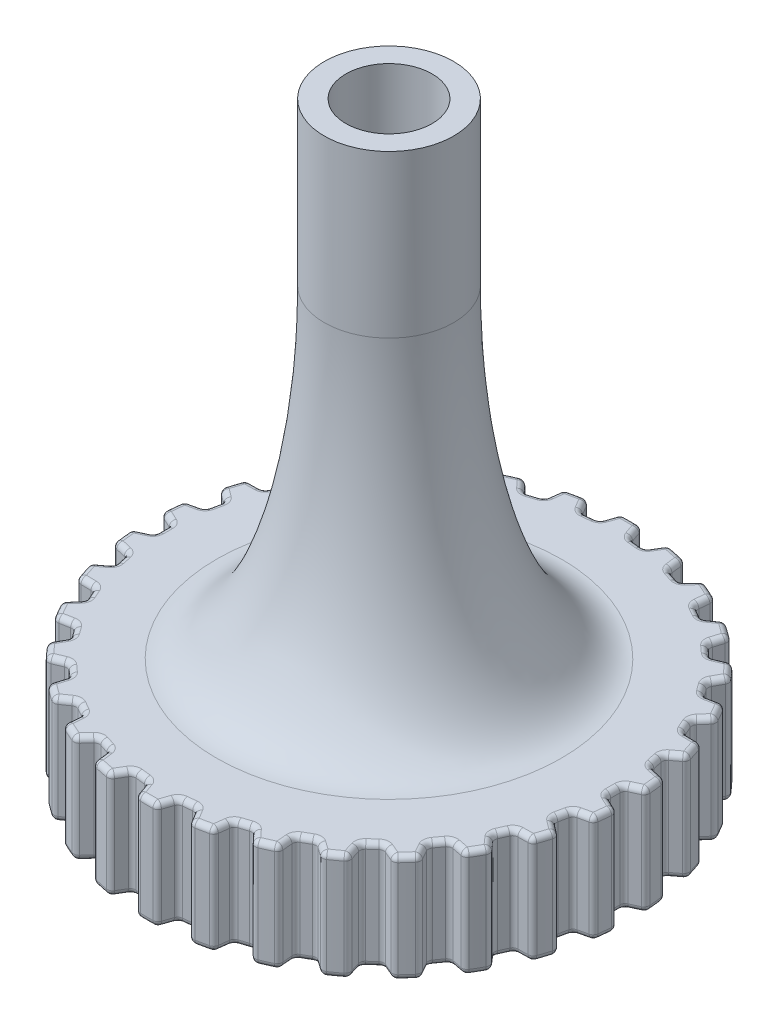
from build123d import *

# Parameters (mm, degrees)
ZAOKR_GLENIE1_SIZE              = 10
ZAOKR_GLENIE1_SIZE_2            = 30
WYTNIJ_WYCI_GNI_CIE1_REACH      = 65.541
ZAOKR_GLENIE2_R                 = 0.5
SZYK_KO_OWY1_COUNT              = 30
ZAOKR_GLENIE2_OF_SZYK_KO_OWY1_R = 0.5
ZAOKR_GLENIE3_R                 = 0.5


with BuildPart() as part:
    # Szkic1 → Obrót1 (revolve)
    with BuildSketch(Plane.XY, mode=Mode.PRIVATE) as obr_t1_sk:
        Polygon((0, -45), (0, -55), (22.5, -55), (22.5, -45), (6, -45), (6, 0), (4, 0), (4, -45), align=None)
    revolve(obr_t1_sk.sketch.rotate(Axis((0, 0, 0), (0, 1, 0)), 90), axis=Axis((0, 0, 0), (0, 1, 0)))

    # Zaokrąglenie1
    # an asymmetric fillet: 30, 10 mm, written as the material it adds along each edge
    with BuildSketch(Plane(origin=(0, -45, 0), x_dir=(0, 0, -1), z_dir=(1, 0, 0))) as zaokr_glenie1_piece_1:
        with BuildLine():
            Bezier((6 + ZAOKR_GLENIE1_SIZE, 0), (6, 0), (6, ZAOKR_GLENIE1_SIZE_2), weights=[1, 0.707106781, 1])
            Line((6, ZAOKR_GLENIE1_SIZE_2), (6, 0))
            Line((6, 0), (6 + ZAOKR_GLENIE1_SIZE, 0))
        make_face()
    revolve(axis=Axis((0, -45, 0), (0, 1, 0)))

    # Szkic2 → Wytnij-wyciągnięcie1 (cut, up to next)
    with BuildSketch(Plane(origin=(0, -55, 0), x_dir=(-1, 0, 0), z_dir=(0, -1, 0)), mode=Mode.PRIVATE) as wytnij_wyci_gni_cie1_sk1:
        Polygon((23.5, 1.915769145), (21, 0.75), (21, -0.75), (23.5, -1.915769145), align=None)
    wytnij_wyci_gni_cie1_tool1 = extrude(wytnij_wyci_gni_cie1_sk1.sketch, amount=-WYTNIJ_WYCI_GNI_CIE1_REACH, mode=Mode.PRIVATE) & part.part
    wytnij_wyci_gni_cie1 = wytnij_wyci_gni_cie1_tool1.solids().sort_by_distance((-22.432213, -55, 0))[0]
    add(wytnij_wyci_gni_cie1, mode=Mode.SUBTRACT)

    # Zaokrąglenie2
    zaokr_glenie2_edges = [part.edges().sort_by_distance(p)[0] for p in [
        (-22.454619967, -50, -1.428300431),
        (-22.454619967, -50, 1.428300431),
        (-21, -50, -0.75),
        (-21, -50, 0.75),
    ]]
    fillet(zaokr_glenie2_edges, radius=ZAOKR_GLENIE2_R)

    # Szyk kołowy1: Wytnij-wyciągnięcie1 ×30 about axis
    szyk_ko_owy1_axis = Axis((0, 0, 0), (0, 1, 0))
    for i in range(1, SZYK_KO_OWY1_COUNT):
        add(wytnij_wyci_gni_cie1.rotate(szyk_ko_owy1_axis, i * 360 / SZYK_KO_OWY1_COUNT), mode=Mode.SUBTRACT)

    # Zaokrąglenie2 of Szyk kołowy1
    zaokr_glenie2_of_szyk_ko_owy1_edges = [part.edges().sort_by_distance(p)[0] for p in [
        (-22.260893004, -50, 3.271489365),
        (-21.666972289, -50, 6.065666643),
        (-20.697033384, -50, 3.632534807),
        (-20.385165847, -50, 5.099756208),
        (-21.094258197, -50, 7.828299377),
        (-19.932373952, -50, 10.437934118),
        (-19.489507093, -50, 7.856310411),
        (-18.879402128, -50, 9.226628598),
        (-19.005703085, -50, 12.042975141),
        (-17.326635227, -50, 14.354013784),
        (-17.430195821, -50, 11.736727552),
        (-16.548517943, -50, 12.950253044),
        (-16.086507548, -50, 15.731315104),
        (-13.9636394, -50, 17.64275417),
        (-14.609101353, -50, 15.10419338),
        (-13.494384114, -50, 16.10788929),
        (-12.464254441, -50, 18.732121109),
        (-9.990365527, -50, 20.160421539),
        (-11.149519053, -50, 17.811533479),
        (-9.850480947, -50, 18.561533479),
        (-8.297253604, -50, 20.914243535),
        (-5.580464741, -50, 21.796981747),
        (-7.202649269, -50, 19.740424096),
        (-5.776064495, -50, 20.203949588),
        (-3.76762297, -50, 22.182313161),
        (-0.926670867, -50, 22.480909259),
        (-2.94098915, -50, 20.806563455),
        (-1.449206307, -50, 20.96335615),
        (0.926670867, -50, 22.480909259),
        (3.76762297, -50, 22.182313161),
        (1.449206307, -50, 20.96335615),
        (2.94098915, -50, 20.806563455),
        (5.580464741, -50, 21.796981747),
        (8.297253604, -50, 20.914243535),
        (5.776064495, -50, 20.203949588),
        (7.202649269, -50, 19.740424096),
        (9.990365527, -50, 20.160421539),
        (12.464254441, -50, 18.732121109),
        (9.850480947, -50, 18.561533479),
        (11.149519053, -50, 17.811533479),
        (13.9636394, -50, 17.64275417),
        (16.086507548, -50, 15.731315104),
        (13.494384114, -50, 16.10788929),
        (14.609101353, -50, 15.10419338),
        (17.326635227, -50, 14.354013784),
        (19.005703085, -50, 12.042975141),
        (16.548517943, -50, 12.950253044),
        (17.430195821, -50, 11.736727552),
        (19.932373952, -50, 10.437934118),
        (21.094258197, -50, 7.828299377),
        (18.879402128, -50, 9.226628598),
        (19.489507093, -50, 7.856310411),
        (21.666972289, -50, 6.065666643),
        (22.260893004, -50, 3.271489365),
        (20.385165847, -50, 5.099756208),
        (20.697033384, -50, 3.632534807),
        (22.454619967, -50, 1.428300431),
        (22.454619967, -50, -1.428300431),
        (21, -50, 0.75),
        (21, -50, -0.75),
        (22.260893004, -50, -3.271489365),
        (21.666972289, -50, -6.065666643),
        (20.697033384, -50, -3.632534807),
        (20.385165847, -50, -5.099756208),
        (21.094258197, -50, -7.828299377),
        (19.932373952, -50, -10.437934118),
        (19.489507093, -50, -7.856310411),
        (18.879402128, -50, -9.226628598),
        (19.005703085, -50, -12.042975141),
        (17.326635227, -50, -14.354013784),
        (17.430195821, -50, -11.736727552),
        (16.548517943, -50, -12.950253044),
        (16.086507548, -50, -15.731315104),
        (13.9636394, -50, -17.64275417),
        (14.609101353, -50, -15.10419338),
        (13.494384114, -50, -16.10788929),
        (12.464254441, -50, -18.732121109),
        (9.990365527, -50, -20.160421539),
        (11.149519053, -50, -17.811533479),
        (9.850480947, -50, -18.561533479),
        (8.297253604, -50, -20.914243535),
        (5.580464741, -50, -21.796981747),
        (7.202649269, -50, -19.740424096),
        (5.776064495, -50, -20.203949588),
        (3.76762297, -50, -22.182313161),
        (0.926670867, -50, -22.480909259),
        (2.94098915, -50, -20.806563455),
        (1.449206307, -50, -20.96335615),
        (-0.926670867, -50, -22.480909259),
        (-3.76762297, -50, -22.182313161),
        (-1.449206307, -50, -20.96335615),
        (-2.94098915, -50, -20.806563455),
        (-5.580464741, -50, -21.796981747),
        (-8.297253604, -50, -20.914243535),
        (-5.776064495, -50, -20.203949588),
        (-7.202649269, -50, -19.740424096),
        (-9.990365527, -50, -20.160421539),
        (-12.464254441, -50, -18.732121109),
        (-9.850480947, -50, -18.561533479),
        (-11.149519053, -50, -17.811533479),
        (-13.9636394, -50, -17.64275417),
        (-16.086507548, -50, -15.731315104),
        (-13.494384114, -50, -16.10788929),
        (-14.609101353, -50, -15.10419338),
        (-17.326635227, -50, -14.354013784),
        (-19.005703085, -50, -12.042975141),
        (-16.548517943, -50, -12.950253044),
        (-17.430195821, -50, -11.736727552),
        (-19.932373952, -50, -10.437934118),
        (-21.094258197, -50, -7.828299377),
        (-18.879402128, -50, -9.226628598),
        (-19.489507093, -50, -7.856310411),
        (-21.666972289, -50, -6.065666643),
        (-22.260893004, -50, -3.271489365),
        (-20.385165847, -50, -5.099756208),
        (-20.697033384, -50, -3.632534807),
    ]]
    fillet(zaokr_glenie2_of_szyk_ko_owy1_edges, radius=ZAOKR_GLENIE2_OF_SZYK_KO_OWY1_R)

    # Zaokrąglenie3
    zaokr_glenie3_edges = [part.edges().sort_by_distance(p)[0] for p in [
        (-9.919306723, -45, 19.348215701),
        (-9.932835045, -45, 18.60440431),
        (-10.5, -45, 18.186533479),
        (-11.145469232, -45, 17.904289636),
        (-11.796392953, -45, 18.264479461),
        (-12.467057648, -45, 18.625140895),
        (-13.225168177, -45, 18.202882373),
        (-13.861028932, -45, 17.612361475),
        (-13.725266313, -45, 16.863070934),
        (-13.583851925, -45, 16.13270091),
        (-14.051742734, -45, 15.606041335),
        (-14.624425119, -45, 15.195764597),
        (-15.336012271, -45, 15.412748759),
        (-16.067007062, -45, 15.626089845),
        (-16.720758573, -45, 15.055438643),
        (-17.219948047, -45, 14.345619158),
        (-16.931365904, -45, 13.640929049),
        (-16.641189293, -45, 12.955921066),
        (-16.989356882, -45, 12.343490298),
        (-17.464223453, -45, 11.823111728),
        (-18.205374262, -45, 11.887406977),
        (-18.964751169, -45, 11.944103686),
        (-19.485571585, -45, 11.25),
        (-19.826272802, -45, 10.451904446),
        (-19.397483559, -45, 9.822613108),
        (-18.971226835, -45, 9.212905303),
        (-19.18445461, -45, 8.541469505),
        (-19.540751419, -45, 7.933732143),
        (-20.279074039, -45, 7.842528469),
        (-21.033644647, -45, 7.740102882),
        (-21.398771617, -45, 6.952882373),
        (-21.566094298, -45, 6.101391356),
        (-21.015838103, -45, 5.57500184),
        (-20.472130731, -45, 5.06724137),
        (-20.541099615, -45, 4.366145507),
        (-20.763254782, -45, 3.697610393),
        (-21.466480971, -45, 3.454893834),
        (-22.183266924, -45, 3.197822441),
        (-22.376742646, -45, 2.351890424),
        (-22.363373988, -45, 1.484218186),
        (-21.715699676, -45, 1.08373624),
        (-21.078304277, -45, 0.700114674),
        (-21, -45, 0),
        (-21.078304277, -45, -0.700114674),
        (-21.715699676, -45, -1.08373624),
        (-22.363373988, -45, -1.484218186),
        (-22.376742646, -45, -2.351890424),
        (-22.183266924, -45, -3.197822441),
        (-21.466480971, -45, -3.454893834),
        (-20.763254782, -45, -3.697610393),
        (-20.541099615, -45, -4.366145507),
        (-20.472130731, -45, -5.06724137),
        (-21.015838103, -45, -5.57500184),
        (-21.566094298, -45, -6.101391356),
        (-21.398771617, -45, -6.952882373),
        (-21.033644647, -45, -7.740102882),
        (-20.279074039, -45, -7.842528469),
        (-19.540751419, -45, -7.933732143),
        (-19.18445461, -45, -8.541469505),
        (-18.971226835, -45, -9.212905303),
        (-19.397483559, -45, -9.822613108),
        (-19.826272802, -45, -10.451904446),
        (-19.485571585, -45, -11.25),
        (-18.964751169, -45, -11.944103686),
        (-18.205374262, -45, -11.887406977),
        (-17.464223453, -45, -11.823111728),
        (-16.989356882, -45, -12.343490298),
        (-16.641189293, -45, -12.955921066),
        (-16.931365904, -45, -13.640929049),
        (-17.219948047, -45, -14.345619158),
        (-16.720758573, -45, -15.055438643),
        (-16.067007062, -45, -15.626089845),
        (-15.336012271, -45, -15.412748759),
        (-14.624425119, -45, -15.195764597),
        (-14.051742734, -45, -15.606041335),
        (-13.583851925, -45, -16.13270091),
        (-13.725266313, -45, -16.863070934),
        (-13.861028932, -45, -17.612361475),
        (-13.225168177, -45, -18.202882373),
        (-12.467057648, -45, -18.625140895),
        (-11.796392953, -45, -18.264479461),
        (-11.145469232, -45, -17.904289636),
        (-10.5, -45, -18.186533479),
        (-9.932835045, -45, -18.60440431),
        (-9.919306723, -45, -19.348215701),
        (-9.89631634, -45, -20.109359081),
        (-9.151574469, -45, -20.554772797),
        (-8.322237991, -45, -20.810183915),
        (-7.741214658, -45, -20.317964768),
        (-7.179402857, -45, -19.830311303),
        (-6.489356882, -45, -19.972186842),
        (-5.847705612, -45, -20.263005967),
        (-5.679825832, -45, -20.987750599),
        (-5.499087237, -45, -21.727481201),
        (-4.678013043, -45, -22.008321017),
        (-3.8136966, -45, -22.08572204),
        (-3.347708136, -45, -21.483457518),
        (-2.899562127, -45, -20.88965321),
        (-2.195097729, -45, -20.884959803),
        (-1.507003382, -45, -21.036017032),
        (-1.192109296, -45, -21.710020085),
        (-0.861521633, -45, -22.396008132),
        (0, -45, -22.5),
        (0.861521633, -45, -22.396008132),
        (1.192109296, -45, -21.710020085),
        (1.507003382, -45, -21.036017032),
        (2.195097729, -45, -20.884959803),
        (2.899562127, -45, -20.88965321),
        (3.347708136, -45, -21.483457518),
        (3.8136966, -45, -22.08572204),
        (4.678013043, -45, -22.008321017),
        (5.499087237, -45, -21.727481201),
        (5.679825832, -45, -20.987750599),
        (5.847705612, -45, -20.263005967),
        (6.489356882, -45, -19.972186842),
        (7.179402857, -45, -19.830311303),
        (7.741214658, -45, -20.317964768),
        (8.322237991, -45, -20.810183915),
        (9.151574469, -45, -20.554772797),
        (9.89631634, -45, -20.109359081),
        (9.919306723, -45, -19.348215701),
        (9.932835045, -45, -18.60440431),
        (10.5, -45, -18.186533479),
        (11.145469232, -45, -17.904289636),
        (11.796392953, -45, -18.264479461),
        (12.467057648, -45, -18.625140895),
        (13.225168177, -45, -18.202882373),
        (13.861028932, -45, -17.612361475),
        (13.725266313, -45, -16.863070934),
        (13.583851925, -45, -16.13270091),
        (14.051742734, -45, -15.606041335),
        (14.624425119, -45, -15.195764597),
        (15.336012271, -45, -15.412748759),
        (16.067007062, -45, -15.626089845),
        (16.720758573, -45, -15.055438643),
        (17.219948047, -45, -14.345619158),
        (16.931365904, -45, -13.640929049),
        (16.641189293, -45, -12.955921066),
        (16.989356882, -45, -12.343490298),
        (17.464223453, -45, -11.823111728),
        (18.205374262, -45, -11.887406977),
        (18.964751169, -45, -11.944103686),
        (19.485571585, -45, -11.25),
        (19.826272802, -45, -10.451904446),
        (19.397483559, -45, -9.822613108),
        (18.971226835, -45, -9.212905303),
        (19.18445461, -45, -8.541469505),
        (19.540751419, -45, -7.933732143),
        (20.279074039, -45, -7.842528469),
        (21.033644647, -45, -7.740102882),
        (21.398771617, -45, -6.952882373),
        (21.566094298, -45, -6.101391356),
        (21.015838103, -45, -5.57500184),
        (20.472130731, -45, -5.06724137),
        (20.541099615, -45, -4.366145507),
        (20.763254782, -45, -3.697610393),
        (21.466480971, -45, -3.454893834),
        (22.183266924, -45, -3.197822441),
        (22.376742646, -45, -2.351890424),
        (22.363373988, -45, -1.484218186),
        (21.715699676, -45, -1.08373624),
        (21.078304277, -45, -0.700114674),
        (21, -45, 0),
        (21.078304277, -45, 0.700114674),
        (21.715699676, -45, 1.08373624),
        (22.363373988, -45, 1.484218186),
        (22.376742646, -45, 2.351890424),
        (22.183266924, -45, 3.197822441),
        (21.466480971, -45, 3.454893834),
        (20.763254782, -45, 3.697610393),
        (20.541099615, -45, 4.366145507),
        (20.472130731, -45, 5.06724137),
        (21.015838103, -45, 5.57500184),
        (21.566094298, -45, 6.101391356),
        (21.398771617, -45, 6.952882373),
        (21.033644647, -45, 7.740102882),
        (20.279074039, -45, 7.842528469),
        (19.540751419, -45, 7.933732143),
        (19.18445461, -45, 8.541469505),
        (18.971226835, -45, 9.212905303),
        (19.397483559, -45, 9.822613108),
        (19.826272802, -45, 10.451904446),
        (19.485571585, -45, 11.25),
        (18.964751169, -45, 11.944103686),
        (18.205374262, -45, 11.887406977),
        (17.464223453, -45, 11.823111728),
        (16.989356882, -45, 12.343490298),
        (16.641189293, -45, 12.955921066),
        (16.931365904, -45, 13.640929049),
        (17.219948047, -45, 14.345619158),
        (16.720758573, -45, 15.055438643),
        (16.067007062, -45, 15.626089845),
        (15.336012271, -45, 15.412748759),
        (14.624425119, -45, 15.195764597),
        (14.051742734, -45, 15.606041335),
        (13.583851925, -45, 16.13270091),
        (13.725266313, -45, 16.863070934),
        (13.861028932, -45, 17.612361475),
        (13.225168177, -45, 18.202882373),
        (12.467057648, -45, 18.625140895),
        (11.796392953, -45, 18.264479461),
        (11.145469232, -45, 17.904289636),
        (10.5, -45, 18.186533479),
        (9.932835045, -45, 18.60440431),
        (9.919306723, -45, 19.348215701),
        (9.89631634, -45, 20.109359081),
        (9.151574469, -45, 20.554772797),
        (8.322237991, -45, 20.810183915),
        (7.741214658, -45, 20.317964768),
        (7.179402857, -45, 19.830311303),
        (6.489356882, -45, 19.972186842),
        (5.847705612, -45, 20.263005967),
        (5.679825832, -45, 20.987750599),
        (5.499087237, -45, 21.727481201),
        (4.678013043, -45, 22.008321017),
        (3.8136966, -45, 22.08572204),
        (3.347708136, -45, 21.483457518),
        (2.899562127, -45, 20.88965321),
        (2.195097729, -45, 20.884959803),
        (1.507003382, -45, 21.036017032),
        (1.192109296, -45, 21.710020085),
        (0.861521633, -45, 22.396008132),
        (0, -45, 22.5),
        (-0.861521633, -45, 22.396008132),
        (-1.192109296, -45, 21.710020085),
        (-1.507003382, -45, 21.036017032),
        (-2.195097729, -45, 20.884959803),
        (-2.899562127, -45, 20.88965321),
        (-3.347708136, -45, 21.483457518),
        (-3.8136966, -45, 22.08572204),
        (-4.678013043, -45, 22.008321017),
        (-5.499087237, -45, 21.727481201),
        (-5.679825832, -45, 20.987750599),
        (-5.847705612, -45, 20.263005967),
        (-6.489356882, -45, 19.972186842),
        (-7.179402857, -45, 19.830311303),
        (-7.741214658, -45, 20.317964768),
        (-8.322237991, -45, 20.810183915),
        (-9.151574469, -45, 20.554772797),
        (-7.179402857, -55, 19.830311303),
        (-7.741214658, -55, 20.317964768),
        (-8.322237991, -55, 20.810183915),
        (-9.151574469, -55, 20.554772797),
        (-9.89631634, -55, 20.109359081),
        (-9.919306723, -55, 19.348215701),
        (-9.932835045, -55, 18.60440431),
        (-10.5, -55, 18.186533479),
        (-11.145469232, -55, 17.904289636),
        (-11.796392953, -55, 18.264479461),
        (-12.467057648, -55, 18.625140895),
        (-13.225168177, -55, 18.202882373),
        (-13.861028932, -55, 17.612361475),
        (-13.725266313, -55, 16.863070934),
        (-13.583851925, -55, 16.13270091),
        (-14.051742734, -55, 15.606041335),
        (-14.624425119, -55, 15.195764597),
        (-15.336012271, -55, 15.412748759),
        (-16.067007062, -55, 15.626089845),
        (-16.720758573, -55, 15.055438643),
        (-17.219948047, -55, 14.345619158),
        (-16.931365904, -55, 13.640929049),
        (-16.641189293, -55, 12.955921066),
        (-16.989356882, -55, 12.343490298),
        (-17.464223453, -55, 11.823111728),
        (-18.205374262, -55, 11.887406977),
        (-18.964751169, -55, 11.944103686),
        (-19.485571585, -55, 11.25),
        (-19.826272802, -55, 10.451904446),
        (-19.397483559, -55, 9.822613108),
        (-18.971226835, -55, 9.212905303),
        (-19.18445461, -55, 8.541469505),
        (-19.540751419, -55, 7.933732143),
        (-20.279074039, -55, 7.842528469),
        (-21.033644647, -55, 7.740102882),
        (-21.398771617, -55, 6.952882373),
        (-21.566094298, -55, 6.101391356),
        (-21.015838103, -55, 5.57500184),
        (-20.472130731, -55, 5.06724137),
        (-20.541099615, -55, 4.366145507),
        (-20.763254782, -55, 3.697610393),
        (-21.466480971, -55, 3.454893834),
        (-22.183266924, -55, 3.197822441),
        (-22.376742646, -55, 2.351890424),
        (-22.363373988, -55, 1.484218186),
        (-21.715699676, -55, 1.08373624),
        (-21.078304277, -55, 0.700114674),
        (-21, -55, 0),
        (-21.078304277, -55, -0.700114674),
        (-21.715699676, -55, -1.08373624),
        (-22.363373988, -55, -1.484218186),
        (-22.376742646, -55, -2.351890424),
        (-22.183266924, -55, -3.197822441),
        (-21.466480971, -55, -3.454893834),
        (-20.763254782, -55, -3.697610393),
        (-20.541099615, -55, -4.366145507),
        (-20.472130731, -55, -5.06724137),
        (-21.015838103, -55, -5.57500184),
        (-21.566094298, -55, -6.101391356),
        (-21.398771617, -55, -6.952882373),
        (-21.033644647, -55, -7.740102882),
        (-20.279074039, -55, -7.842528469),
        (-19.540751419, -55, -7.933732143),
        (-19.18445461, -55, -8.541469505),
        (-18.971226835, -55, -9.212905303),
        (-19.397483559, -55, -9.822613108),
        (-19.826272802, -55, -10.451904446),
        (-19.485571585, -55, -11.25),
        (-18.964751169, -55, -11.944103686),
        (-18.205374262, -55, -11.887406977),
        (-17.464223453, -55, -11.823111728),
        (-16.989356882, -55, -12.343490298),
        (-16.641189293, -55, -12.955921066),
        (-16.931365904, -55, -13.640929049),
        (-17.219948047, -55, -14.345619158),
        (-16.720758573, -55, -15.055438643),
        (-16.067007062, -55, -15.626089845),
        (-15.336012271, -55, -15.412748759),
        (-14.624425119, -55, -15.195764597),
        (-14.051742734, -55, -15.606041335),
        (-13.583851925, -55, -16.13270091),
        (-13.725266313, -55, -16.863070934),
        (-13.861028932, -55, -17.612361475),
        (-13.225168177, -55, -18.202882373),
        (-12.467057648, -55, -18.625140895),
        (-11.796392953, -55, -18.264479461),
        (-11.145469232, -55, -17.904289636),
        (-10.5, -55, -18.186533479),
        (-9.932835045, -55, -18.60440431),
        (-9.919306723, -55, -19.348215701),
        (-9.89631634, -55, -20.109359081),
        (-9.151574469, -55, -20.554772797),
        (-8.322237991, -55, -20.810183915),
        (-7.741214658, -55, -20.317964768),
        (-7.179402857, -55, -19.830311303),
        (-6.489356882, -55, -19.972186842),
        (-5.847705612, -55, -20.263005967),
        (-5.679825832, -55, -20.987750599),
        (-5.499087237, -55, -21.727481201),
        (-4.678013043, -55, -22.008321017),
        (-3.8136966, -55, -22.08572204),
        (-3.347708136, -55, -21.483457518),
        (-2.899562127, -55, -20.88965321),
        (-2.195097729, -55, -20.884959803),
        (-1.507003382, -55, -21.036017032),
        (-1.192109296, -55, -21.710020085),
        (-0.861521633, -55, -22.396008132),
        (0, -55, -22.5),
        (0.861521633, -55, -22.396008132),
        (1.192109296, -55, -21.710020085),
        (1.507003382, -55, -21.036017032),
        (2.195097729, -55, -20.884959803),
        (2.899562127, -55, -20.88965321),
        (3.347708136, -55, -21.483457518),
        (3.8136966, -55, -22.08572204),
        (4.678013043, -55, -22.008321017),
        (5.499087237, -55, -21.727481201),
        (5.679825832, -55, -20.987750599),
        (5.847705612, -55, -20.263005967),
        (6.489356882, -55, -19.972186842),
        (7.179402857, -55, -19.830311303),
        (7.741214658, -55, -20.317964768),
        (8.322237991, -55, -20.810183915),
        (9.151574469, -55, -20.554772797),
        (9.89631634, -55, -20.109359081),
        (9.919306723, -55, -19.348215701),
        (9.932835045, -55, -18.60440431),
        (10.5, -55, -18.186533479),
        (11.145469232, -55, -17.904289636),
        (11.796392953, -55, -18.264479461),
        (12.467057648, -55, -18.625140895),
        (13.225168177, -55, -18.202882373),
        (13.861028932, -55, -17.612361475),
        (13.725266313, -55, -16.863070934),
        (13.583851925, -55, -16.13270091),
        (14.051742734, -55, -15.606041335),
        (14.624425119, -55, -15.195764597),
        (15.336012271, -55, -15.412748759),
        (16.067007062, -55, -15.626089845),
        (16.720758573, -55, -15.055438643),
        (17.219948047, -55, -14.345619158),
        (16.931365904, -55, -13.640929049),
        (16.641189293, -55, -12.955921066),
        (16.989356882, -55, -12.343490298),
        (17.464223453, -55, -11.823111728),
        (18.205374262, -55, -11.887406977),
        (18.964751169, -55, -11.944103686),
        (19.485571585, -55, -11.25),
        (19.826272802, -55, -10.451904446),
        (19.397483559, -55, -9.822613108),
        (18.971226835, -55, -9.212905303),
        (19.18445461, -55, -8.541469505),
        (19.540751419, -55, -7.933732143),
        (20.279074039, -55, -7.842528469),
        (21.033644647, -55, -7.740102882),
        (21.398771617, -55, -6.952882373),
        (21.566094298, -55, -6.101391356),
        (21.015838103, -55, -5.57500184),
        (20.472130731, -55, -5.06724137),
        (20.541099615, -55, -4.366145507),
        (20.763254782, -55, -3.697610393),
    ]]
    fillet(zaokr_glenie3_edges, radius=ZAOKR_GLENIE3_R)


solid = part.part
